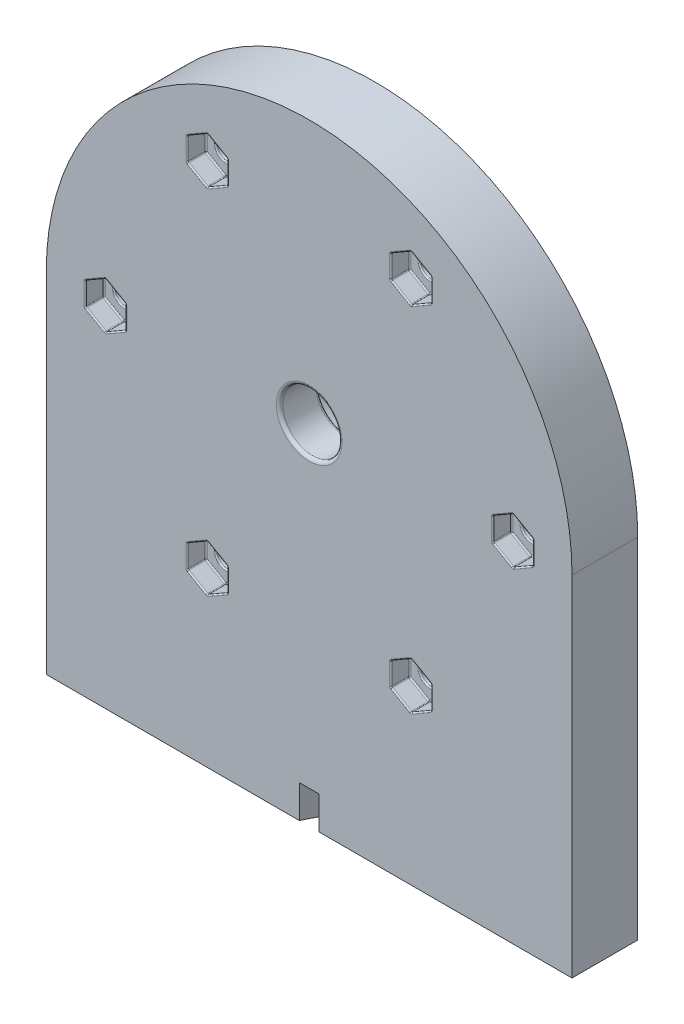
from build123d import *

# Parameters (mm, degrees)
SKETCH1_R                = 40
SKETCH1_R_2              = 4.5
BOSS_EXTRUDE1_DEPTH      = 5
CUT_EXTRUDE1_START       = 5
CUT_EXTRUDE1_DEPTH       = 2.8575
CUT_EXTRUDE2_START       = -2.1425
SKETCH3_R                = 1.5875
CUT_EXTRUDE2_DEPTH       = 7.1425
FILLET2_R                = 0.2
CIRPATTERN1_COUNT        = 6
FILLET2_OF_CIRPATTERN1_R = 0.2
BOSS_EXTRUDE2_START      = -5
BOSS_EXTRUDE2_DEPTH      = 10
SKETCH9_R                = 7.6
CUT_EXTRUDE3_DEPTH       = 4
FILLET3_R                = 0.5
CUT_EXTRUDE4_DEPTH       = 5


# Read off the part's stored shape, not the designer's step: Boss-Extrude2
with BuildPart() as part:
    # Sketch1 → Boss-Extrude1 (new, symmetric)
    with BuildSketch(Plane.XY):
        Circle(SKETCH1_R)
        Circle(SKETCH1_R_2, mode=Mode.SUBTRACT)
    extrude(amount=BOSS_EXTRUDE1_DEPTH, both=True)

    # Sketch2 → Cut-Extrude1 (cut)
    with BuildSketch(Plane.XY.offset(CUT_EXTRUDE1_START)):
        Polygon((-27.952, -1.75976362), (-27.952, 1.75976362), (-31, 3.519527241), (-34.048, 1.75976362), (-34.048, -1.75976362), (-31, -3.519527241), align=None)
    cut_extrude1 = extrude(amount=-CUT_EXTRUDE1_DEPTH, mode=Mode.SUBTRACT)

    # Sketch3 → Cut-Extrude2 (cut)
    with BuildSketch(Plane(origin=(0, 0, 0), x_dir=(-1, 0, 0), z_dir=(0, 0, -1)).offset(CUT_EXTRUDE2_START)):
        with Locations(Location((31, 0, 0), (0, 0, 180))):
            Circle(SKETCH3_R)
    cut_extrude2 = extrude(amount=CUT_EXTRUDE2_DEPTH, mode=Mode.SUBTRACT)

    # Fillet2
    fillet2_edges = [part.edges().sort_by_distance(p)[0] for p in [
        (-34.048, 0, 5),
        (-34.048, -1.75976362, 3.57125),
        (-32.524, 2.639645431, 5),
        (-34.048, 1.75976362, 3.57125),
        (-29.476, 2.639645431, 5),
        (-31, 3.519527241, 3.57125),
        (-27.952, 0, 5),
        (-27.952, 1.75976362, 3.57125),
        (-29.476, -2.639645431, 5),
        (-27.952, -1.75976362, 3.57125),
        (-32.524, -2.639645431, 5),
        (-31, -3.519527241, 3.57125),
        (-34.048, 0, 2.1425),
        (-32.524, 2.639645431, 2.1425),
        (-29.476, 2.639645431, 2.1425),
        (-27.952, 0, 2.1425),
        (-29.476, -2.639645431, 2.1425),
        (-32.524, -2.639645431, 2.1425),
        (-32.5875, 0, 2.1425),
        (-32.5875, 0, -5),
    ]]
    fillet(fillet2_edges, radius=FILLET2_R)

    # CirPattern1: Cut-Extrude1, Cut-Extrude2 ×6 about axis
    cirpattern1_axis = Axis((0, 0, 0), (0, 0, 1))
    add([cut_extrude1.rotate(cirpattern1_axis, i * 360 / CIRPATTERN1_COUNT) for i in range(1, CIRPATTERN1_COUNT)], mode=Mode.SUBTRACT)
    add([cut_extrude2.rotate(cirpattern1_axis, i * 360 / CIRPATTERN1_COUNT) for i in range(1, CIRPATTERN1_COUNT)], mode=Mode.SUBTRACT)

    # Fillet2 of CirPattern1
    fillet2_of_cirpattern1_edges = [part.edges().sort_by_distance(p)[0] for p in [
        (-17.024, -29.486432948, 5),
        (-15.5, -30.366314758, 3.57125),
        (-18.548, -26.846787517, 5),
        (-18.548, -28.606551138, 3.57125),
        (-17.024, -24.207142087, 5),
        (-18.548, -25.087023897, 3.57125),
        (-13.976, -24.207142087, 5),
        (-15.5, -23.327260276, 3.57125),
        (-12.452, -26.846787517, 5),
        (-12.452, -25.087023897, 3.57125),
        (-13.976, -29.486432948, 5),
        (-12.452, -28.606551138, 3.57125),
        (-17.024, -29.486432948, 2.1425),
        (-18.548, -26.846787517, 2.1425),
        (-17.024, -24.207142087, 2.1425),
        (-13.976, -24.207142087, 2.1425),
        (-12.452, -26.846787517, 2.1425),
        (-13.976, -29.486432948, 2.1425),
        (-16.29375, -28.221602846, 2.1425),
        (-16.29375, -28.221602846, -5),
        (17.024, -29.486432948, 5),
        (18.548, -28.606551138, 3.57125),
        (13.976, -29.486432948, 5),
        (15.5, -30.366314758, 3.57125),
        (12.452, -26.846787517, 5),
        (12.452, -28.606551138, 3.57125),
        (13.976, -24.207142087, 5),
        (12.452, -25.087023897, 3.57125),
        (17.024, -24.207142087, 5),
        (15.5, -23.327260276, 3.57125),
        (18.548, -26.846787517, 5),
        (18.548, -25.087023897, 3.57125),
        (17.024, -29.486432948, 2.1425),
        (13.976, -29.486432948, 2.1425),
        (12.452, -26.846787517, 2.1425),
        (13.976, -24.207142087, 2.1425),
        (17.024, -24.207142087, 2.1425),
        (18.548, -26.846787517, 2.1425),
        (16.29375, -28.221602846, 2.1425),
        (16.29375, -28.221602846, -5),
        (34.048, 0, 5),
        (34.048, 1.75976362, 3.57125),
        (32.524, -2.639645431, 5),
        (34.048, -1.75976362, 3.57125),
        (29.476, -2.639645431, 5),
        (31, -3.519527241, 3.57125),
        (27.952, 0, 5),
        (27.952, -1.75976362, 3.57125),
        (29.476, 2.639645431, 5),
        (27.952, 1.75976362, 3.57125),
        (32.524, 2.639645431, 5),
        (31, 3.519527241, 3.57125),
        (34.048, 0, 2.1425),
        (32.524, -2.639645431, 2.1425),
        (29.476, -2.639645431, 2.1425),
        (27.952, 0, 2.1425),
        (29.476, 2.639645431, 2.1425),
        (32.524, 2.639645431, 2.1425),
        (32.5875, 0, 2.1425),
        (32.5875, 0, -5),
        (17.024, 29.486432948, 5),
        (15.5, 30.366314758, 3.57125),
        (18.548, 26.846787517, 5),
        (18.548, 28.606551138, 3.57125),
        (17.024, 24.207142087, 5),
        (18.548, 25.087023897, 3.57125),
        (13.976, 24.207142087, 5),
        (15.5, 23.327260276, 3.57125),
        (12.452, 26.846787517, 5),
        (12.452, 25.087023897, 3.57125),
        (13.976, 29.486432948, 5),
        (12.452, 28.606551138, 3.57125),
        (17.024, 29.486432948, 2.1425),
        (18.548, 26.846787517, 2.1425),
        (17.024, 24.207142087, 2.1425),
        (13.976, 24.207142087, 2.1425),
        (12.452, 26.846787517, 2.1425),
        (13.976, 29.486432948, 2.1425),
        (16.29375, 28.221602846, 2.1425),
        (16.29375, 28.221602846, -5),
        (-17.024, 29.486432948, 5),
        (-18.548, 28.606551138, 3.57125),
        (-13.976, 29.486432948, 5),
        (-15.5, 30.366314758, 3.57125),
        (-12.452, 26.846787517, 5),
        (-12.452, 28.606551138, 3.57125),
        (-13.976, 24.207142087, 5),
        (-12.452, 25.087023897, 3.57125),
        (-17.024, 24.207142087, 5),
        (-15.5, 23.327260276, 3.57125),
        (-18.548, 26.846787517, 5),
        (-18.548, 25.087023897, 3.57125),
        (-17.024, 29.486432948, 2.1425),
        (-13.976, 29.486432948, 2.1425),
        (-12.452, 26.846787517, 2.1425),
        (-13.976, 24.207142087, 2.1425),
        (-17.024, 24.207142087, 2.1425),
        (-18.548, 26.846787517, 2.1425),
        (-16.29375, 28.221602846, 2.1425),
        (-16.29375, 28.221602846, -5),
    ]]
    fillet(fillet2_of_cirpattern1_edges, radius=FILLET2_OF_CIRPATTERN1_R)

    # Boss-Extrude2 outline → Boss-Extrude2 (add)
    with BuildSketch(Plane.XY.offset(BOSS_EXTRUDE2_START)):
        with BuildLine():
            Line((-40, 0), (-40, -53.1))
            Line((-40, -53.1), (40, -53.1))
            Line((40, -53.1), (40, 0))
            ThreePointArc((40, 0), (0, -40), (-40, 0))
        make_face()
    extrude(amount=BOSS_EXTRUDE2_DEPTH)

    # Sketch9 → Cut-Extrude3 (cut)
    with BuildSketch(Plane(origin=(0, 0, -5), x_dir=(-1, 0, 0), z_dir=(0, 0, -1))):
        Circle(SKETCH9_R)
    extrude(amount=-CUT_EXTRUDE3_DEPTH, mode=Mode.SUBTRACT)

    # Fillet3
    fillet3_edges = [part.edges().sort_by_distance(p)[0] for p in [
        (-4.5, 0, 5),
        (7.6, 0, -1),
        (-4.5, 0, -1),
        (7.6, 0, -5),
    ]]
    fillet(fillet3_edges, radius=FILLET3_R)

    # Sketch12 → Cut-Extrude4 (cut)
    with BuildSketch(Plane.XZ.offset(53.1)):
        Polygon((-1.5, 5), (0, 2), (1.5, 5), align=None)
        Polygon((-1.5, -5), (0, -2), (1.5, -5), align=None)
    extrude(amount=-CUT_EXTRUDE4_DEPTH, mode=Mode.SUBTRACT)


solid = part.part
